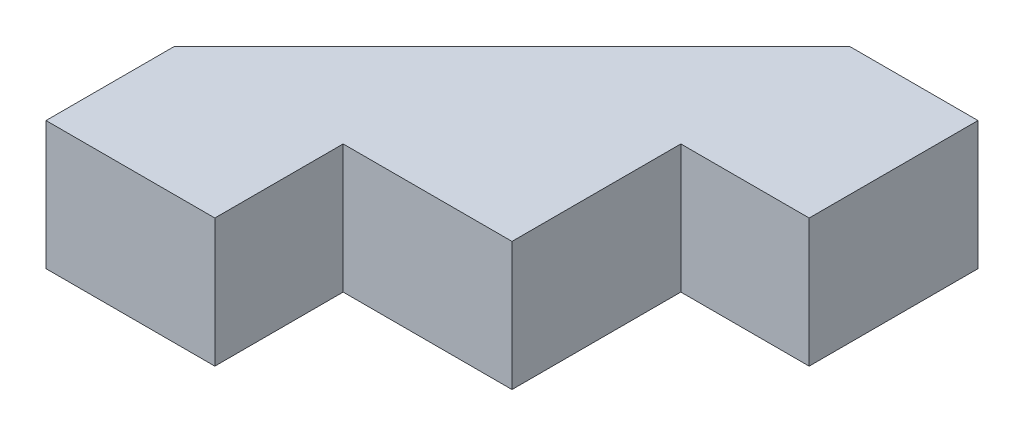
from build123d import *

# Parameters (mm, degrees)
BOSS_EXTRUDE1_DEPTH = 4.826


with BuildPart() as part:
    # Sketch1 → Boss-Extrude1 (new body)
    with BuildSketch(Plane(origin=(0, 0, 0), x_dir=(1, 0, 0), z_dir=(0, 1, 0))):
        Polygon((4.338014563, -0.922114223), (-8.361985437, -13.622114223), (-8.361985437, -18.448114223), (-2.011985437, -18.448114223), (-2.011985437, -13.622114223), (4.338014563, -13.622114223), (4.338014563, -7.272114223), (9.164014563, -7.272114223), (9.164014563, -0.922114223), align=None)
    extrude(amount=BOSS_EXTRUDE1_DEPTH)


solid = part.part
